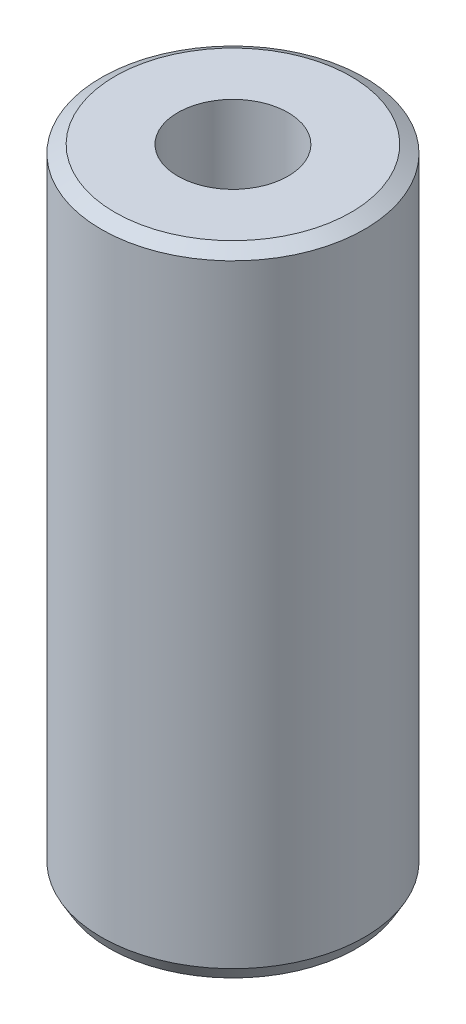
from build123d import *
from OCP.BRepFilletAPI import BRepFilletAPI_MakeChamfer

# Parameters (mm, degrees)
SKETCH1_R           = 50
BOSS_EXTRUDE1_DEPTH = 241.084132096
SKETCH2_R           = 20.953244889
CUT_EXTRUDE1_DEPTH  = 252.240042088
CHAMFER1_SIZE       = 2.986602946
CHAMFER1_SIZE2      = 5.172948044


with BuildPart() as part:
    # Sketch1 → Boss-Extrude1 (new body)
    with BuildSketch(Plane(origin=(0, 0, 0), x_dir=(1, 0, 0), z_dir=(0, 1, 0))):
        Circle(SKETCH1_R)
    extrude(amount=BOSS_EXTRUDE1_DEPTH)

    # Sketch2 → Cut-Extrude1 (cut, through all)
    with BuildSketch(Plane(origin=(0, 0, 0), x_dir=(1, 0, 0), z_dir=(0, 1, 0))):
        Circle(SKETCH2_R)
    extrude(amount=CUT_EXTRUDE1_DEPTH, mode=Mode.SUBTRACT)

    # Chamfer1: one chamfer whose edges measure the first distance from different faces: ONE call of the kernel's chamfer builder (chamfer() names one face for all edges)
    chamfer1_edges_1 = [part.edges().sort_by_distance(p)[0] for p in [
        (-50, 241.084132096, 0),
    ]]
    chamfer1_side_1 = [part.faces().sort_by_distance(p)[0] for p in [
        (-50, 120.542066048, 0),
    ]]
    chamfer1_edges_2 = [part.edges().sort_by_distance(p)[0] for p in [
        (-50, 0, 0),
    ]]
    chamfer1_side_2 = [part.faces().sort_by_distance(p)[0] for p in [
        (-48.585786438, 0, 0),
    ]]
    chamfer1 = BRepFilletAPI_MakeChamfer(part.part.solid().wrapped)
    for e in chamfer1_edges_1:
        chamfer1.Add(CHAMFER1_SIZE, CHAMFER1_SIZE2, e.wrapped, chamfer1_side_1[0].wrapped)  # the first distance lies on this face
    for e in chamfer1_edges_2:
        chamfer1.Add(CHAMFER1_SIZE, CHAMFER1_SIZE2, e.wrapped, chamfer1_side_2[0].wrapped)  # the first distance lies on this face
    add(Compound.cast(chamfer1.Shape()), mode=Mode.REPLACE)


solid = part.part
